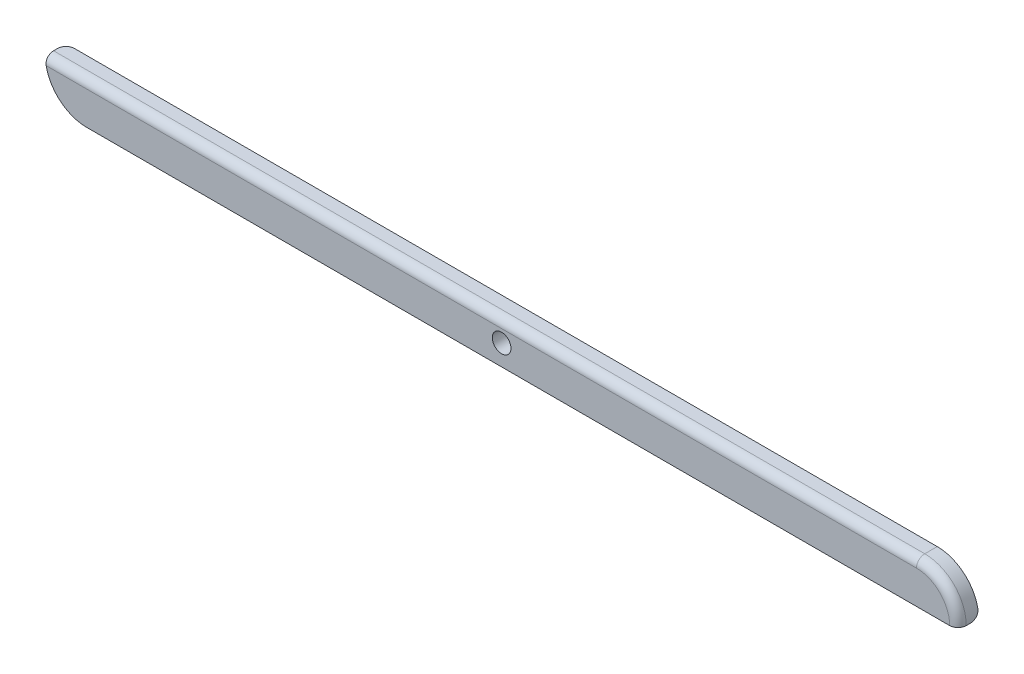
from build123d import *

# Parameters (mm, degrees)
SKETCH28_W           = 220
SKETCH28_H           = 10
SKETCH28_R           = 2.25
BOSS_EXTRUDE11_DEPTH = 5
VARFILLET1_R         = 10
VARFILLET2_R         = 10
VARFILLET3_R         = 2
VARFILLET4_R         = 2


with BuildPart() as part:
    # Sketch28 → Boss-Extrude11 (new body)
    with BuildSketch(Plane.XY.offset(170)):
        with Locations((200, 200)):
            Rectangle(SKETCH28_W, SKETCH28_H)
        with Locations((200, 200)):
            Circle(SKETCH28_R, mode=Mode.SUBTRACT)
    extrude(amount=BOSS_EXTRUDE11_DEPTH)

    # VarFillet1
    varfillet1_edges = [part.edges().sort_by_distance(p)[0] for p in [
        (310, 205, 172.5),
    ]]
    fillet(varfillet1_edges, radius=VARFILLET1_R - 0.0001)  # a hair under: the kernel refuses the full size

    # VarFillet2
    varfillet2_edges = [part.edges().sort_by_distance(p)[0] for p in [
        (90, 195, 172.5),
    ]]
    fillet(varfillet2_edges, radius=VARFILLET2_R - 0.0001)  # a hair under: the kernel refuses the full size

    # VarFillet3
    varfillet3_edges = [part.edges().sort_by_distance(p)[0] for p in [
        (307.071097101, 202.071097101, 175),
    ]]
    fillet(varfillet3_edges, radius=VARFILLET3_R)

    # VarFillet4
    varfillet4_edges = [part.edges().sort_by_distance(p)[0] for p in [
        (92.928902899, 197.928902899, 170),
    ]]
    fillet(varfillet4_edges, radius=VARFILLET4_R)


solid = part.part
